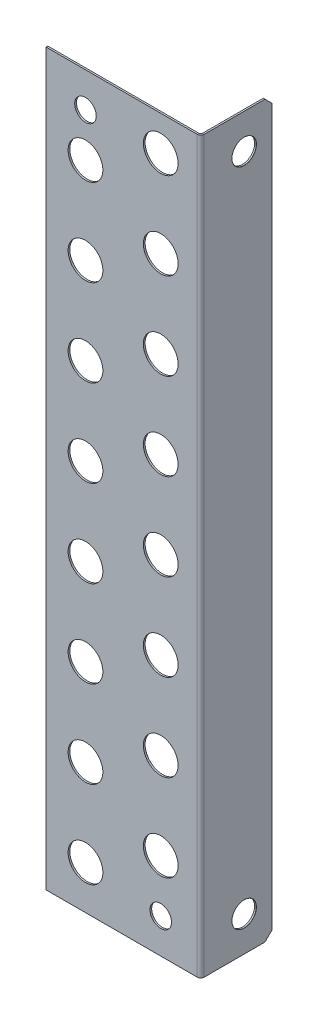
from build123d import *

# Parameters (mm, degrees)
SKETCH2_W                          = 44
SKETCH2_H                          = 210
BOSS_EXTRUDE1_DEPTH                = 0.5
SKETCH3_R                          = 5
CUT_EXTRUDE1_DEPTH                 = 108.281172626
LPATTERN1_COUNT                    = 8
LPATTERN1_PITCH                    = 25
EDGE_FLANGE1_STRIP_W               = 3
EDGE_FLANGE1_STRIP_H               = 0.5
EDGE_FLANGE1_STRIP_CUT_DEPTH       = 210
EDGE_FLANGE1_DEPTH                 = 210
F_7_0_7_DIAMETER_HOLE1_D           = 7
F_7_0_7_DIAMETER_HOLE1_DEPTH       = 60
F_7_0_7_DIAMETER_HOLE1_CSINK_D     = 7.05
F_7_0_7_DIAMETER_HOLE1_CSINK_ANGLE = 90
F_7_0_7_DIAMETER_HOLE1_TIP         = 2.103012167
BREAK_CORNER1_START                = 86.974134086
BREAK_CORNER1_OUTLINE_W            = 3
BREAK_CORNER1_OUTLINE_H            = 149.974134086
BREAK_CORNER1_DEPTH                = 1.414213562
BREAK_CORNER1_START_2              = -61.518289963
BREAK_CORNER1_2_OUTLINE_W          = 3
BREAK_CORNER1_2_OUTLINE_H          = 2.025865914
BREAK_CORNER1_2_DEPTH              = 2.828427125
SKETCH17_R                         = 3.1
CUT_EXTRUDE2_DEPTH                 = 10


# Read off the part's stored shape, not the designer's step: Break-Corner1
# Sheet-metal steps are written as plain solids
with BuildPart() as part:
    # Sketch2 → Boss-Extrude1 (new body)
    with BuildSketch(Plane.XY):
        Rectangle(SKETCH2_W, SKETCH2_H)
    extrude(amount=BOSS_EXTRUDE1_DEPTH)

    # Sketch3 → Cut-Extrude1 (cut, through all)
    with BuildSketch(Plane.XY.offset(0.5)):
        with Locations((11, 95)):
            Circle(SKETCH3_R)
        with Locations((-10.650635095, 82.5)):
            Circle(SKETCH3_R)
    cut_extrude1 = extrude(amount=-CUT_EXTRUDE1_DEPTH, mode=Mode.SUBTRACT)

    # LPattern1: Cut-Extrude1 ×8
    with Locations(*[(0, -i * LPATTERN1_PITCH, 0) for i in range(1, LPATTERN1_COUNT)]):
        add(cut_extrude1, mode=Mode.SUBTRACT)

    # Edge-Flange1 strip (across the edge) → Edge-Flange1 strip cut (cut)
    with BuildSketch(Plane(origin=(22, 105, 0), x_dir=(-1, 0, 0), z_dir=(0, -1, 0))):
        with Locations((-1, -0.25)):
            Rectangle(EDGE_FLANGE1_STRIP_W, EDGE_FLANGE1_STRIP_H)
    extrude(amount=EDGE_FLANGE1_STRIP_CUT_DEPTH, mode=Mode.SUBTRACT)

    # Edge-Flange1 section (across the edge) → Edge-Flange1 (add)
    with BuildSketch(Plane(origin=(22, 105, 0), x_dir=(-1, 0, 0), z_dir=(0, -1, 0))):
        with BuildLine():
            Line((-0.5, 0.5), (-0.5, 20))
            Line((-0.5, 20), (0, 20))
            Line((0, 20), (0, 0.5))
            ThreePointArc((0, 0.5), (0.146446609, 0.146446609), (0.5, 0))
            Line((0.5, 0), (0.5, -0.5))
            ThreePointArc((0.5, -0.5), (-0.207106781, -0.207106781), (-0.5, 0.5))
        make_face()
    extrude(amount=EDGE_FLANGE1_DEPTH)

    # Ø7.0 (7) Diameter Hole1
    with Locations(Plane(origin=(22.5, 0, 0), x_dir=(0, 0, -1), z_dir=(1, 0, 0))):
        with Locations((12, 95), (12, -95)):
            CounterSinkHole(F_7_0_7_DIAMETER_HOLE1_D / 2, F_7_0_7_DIAMETER_HOLE1_CSINK_D / 2, depth=F_7_0_7_DIAMETER_HOLE1_DEPTH, counter_sink_angle=F_7_0_7_DIAMETER_HOLE1_CSINK_ANGLE)
            with Locations((0, 0, -(F_7_0_7_DIAMETER_HOLE1_DEPTH + F_7_0_7_DIAMETER_HOLE1_TIP / 2))):  # 118° drill point
                Cone(0, F_7_0_7_DIAMETER_HOLE1_D / 2, F_7_0_7_DIAMETER_HOLE1_TIP, mode=Mode.SUBTRACT)

    # Break-Corner1 outline → Break-Corner1 (cut)
    with BuildSketch(Plane(origin=(0, 0, 0), x_dir=(1, 0, 0), z_dir=(0, 0.707106781186545, -0.70710678118655)).offset(BREAK_CORNER1_START)):
        with Locations((22.5, 11.987067043)):
            Rectangle(BREAK_CORNER1_OUTLINE_W, BREAK_CORNER1_OUTLINE_H)
    extrude(amount=BREAK_CORNER1_DEPTH, mode=Mode.SUBTRACT)

    # Break-Corner1 2 outline → Break-Corner1 2 (cut)
    with BuildSketch(Plane(origin=(0, 0, 0), x_dir=(1, 0, 0), z_dir=(0, 0.707106781186545, -0.70710678118655)).offset(BREAK_CORNER1_START_2)):
        with Locations((22.5, 87.987067043)):
            Rectangle(BREAK_CORNER1_2_OUTLINE_W, BREAK_CORNER1_2_OUTLINE_H)
    extrude(amount=BREAK_CORNER1_2_DEPTH, mode=Mode.SUBTRACT)

    # Sketch17 → Cut-Extrude2 (cut)
    with BuildSketch(Plane.XY):
        with Locations((-10.650635095, 95)):
            Circle(SKETCH17_R)
        with Locations((11, -95)):
            Circle(SKETCH17_R)
    extrude(amount=CUT_EXTRUDE2_DEPTH, mode=Mode.SUBTRACT)


solid = part.part
